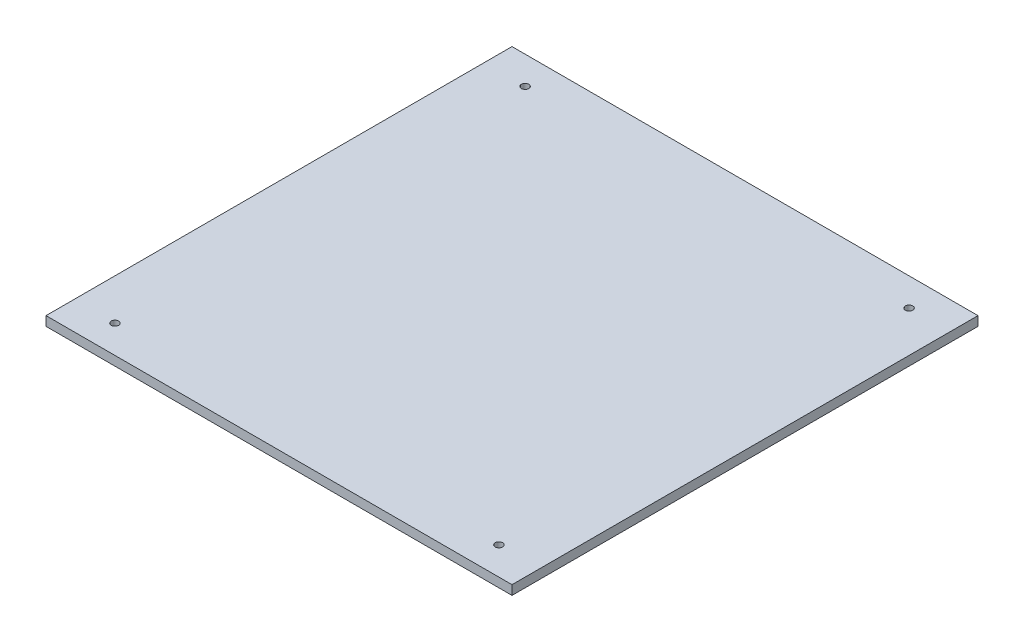
from build123d import *

# Parameters (mm, degrees)
SKETCH2_W            = 250
SKETCH2_H            = 250
BOSS_EXTRUDE1_DEPTH  = 5
SKETCH3_R            = 2
CUT_EXTRUDE1_DEPTH   = 354.588744165
LPATTERN1_COUNT      = 2
LPATTERN1_PITCH      = 220
LPATTERN1_COUNT_DIR2 = 2
LPATTERN1_PITCH_DIR2 = 206


with BuildPart() as part:
    # Sketch2 → Boss-Extrude1 (new body)
    with BuildSketch(Plane(origin=(0, 0, 0), x_dir=(1, 0, 0), z_dir=(0, 1, 0))):
        with Locations((125, 125)):
            Rectangle(SKETCH2_W, SKETCH2_H)
    extrude(amount=BOSS_EXTRUDE1_DEPTH)

    # Sketch3 → Cut-Extrude1 (cut, through all)
    with BuildSketch(Plane(origin=(0, 5, 0), x_dir=(1, 0, 0), z_dir=(0, 1, 0))):
        with Locations((22, 15)):
            Circle(SKETCH3_R)
    cut_extrude1 = extrude(amount=-CUT_EXTRUDE1_DEPTH, mode=Mode.SUBTRACT)

    # LPattern1: Cut-Extrude1 2 × 2
    with Locations(*[(j * LPATTERN1_PITCH_DIR2, 0, -i * LPATTERN1_PITCH) for i in range(LPATTERN1_COUNT) for j in range(LPATTERN1_COUNT_DIR2) if (i, j) != (0, 0)]):
        add(cut_extrude1, mode=Mode.SUBTRACT)


solid = part.part
